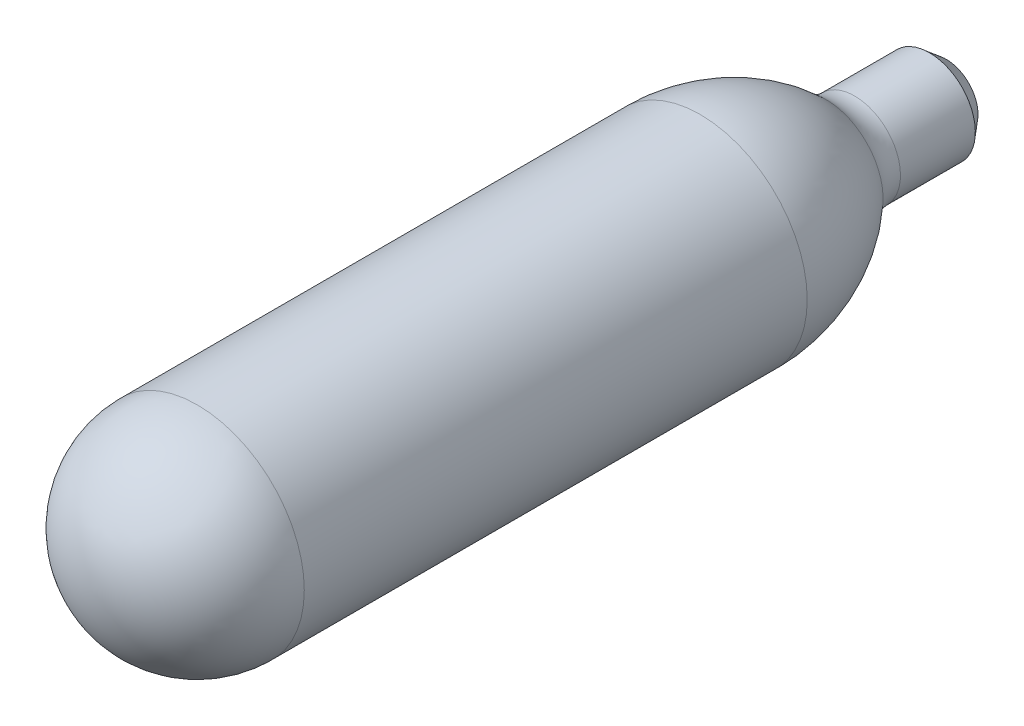
from build123d import *


# Read off the part's stored shape, not the designer's step: Shell1
with BuildPart() as part:
    # Sketch3 → Revolve3 (revolve)
    with BuildSketch(Plane(origin=(0, 0, 0), x_dir=(0, 0, -1), z_dir=(1, 0, 0)), mode=Mode.PRIVATE) as revolve3_sk:
        with BuildLine():
            Line((40.933444221, 9.132480421), (48.707266624, 9.132480421))
            Line((48.707266624, 9.132480421), (50.458444221, 7.663067945))
            Line((50.458444221, 7.663067945), (50.458444221, 4.369980421))
            Line((50.458444221, 4.369980421), (-38.441555779, 4.369980421))
            ThreePointArc((-38.441555779, 4.369980421), (-35.186779885, 12.227704527), (-27.329055779, 15.482480421))
            Line((-27.329055779, 15.482480421), (24.901639323, 15.482480421))
            ThreePointArc((24.901639323, 15.482480421), (31.916856339, 14.14375452), (37.946094067, 10.315732937))
            ThreePointArc((37.946094067, 10.315732937), (39.32686809, 9.439066101), (40.933444221, 9.132480421))
        make_face()
    revolve(revolve3_sk.sketch.rotate(Axis((0, 4.369980421, 38.441555779), (0, 0, -1)), 180), axis=Axis((0, 4.369980421, 38.441555779), (0, 0, -1)))

    # Shell1 outline → Shell1 (revolve, cut)
    with BuildSketch(Plane.XZ.offset(-4.369980421)):
        with BuildLine():
            ThreePointArc((4.09465218, -36.206833435), (7.412270886, -30.981494071), (8.5725, -24.901639323))
            Line((8.5725, -24.901639323), (8.5725, 27.329055776))
            ThreePointArc((8.5725, 27.329055776), (6.061672883, 33.39072866), (0, 35.901555779))
            Line((0, 35.901555779), (0, -47.918444221))
            Line((0, -47.918444221), (2.108666073, -47.918444221))
            Line((2.108666073, -47.918444221), (2.2225, -47.782782229))
            Line((2.2225, -47.782782229), (2.2225, -40.933444221))
            ThreePointArc((2.2225, -40.933444221), (2.707582467, -38.391505822), (4.09465218, -36.206833435))
        make_face()
    revolve(axis=Axis((0, 4.369980421, 0), (0, 0, 1)), mode=Mode.SUBTRACT)


solid = part.part
